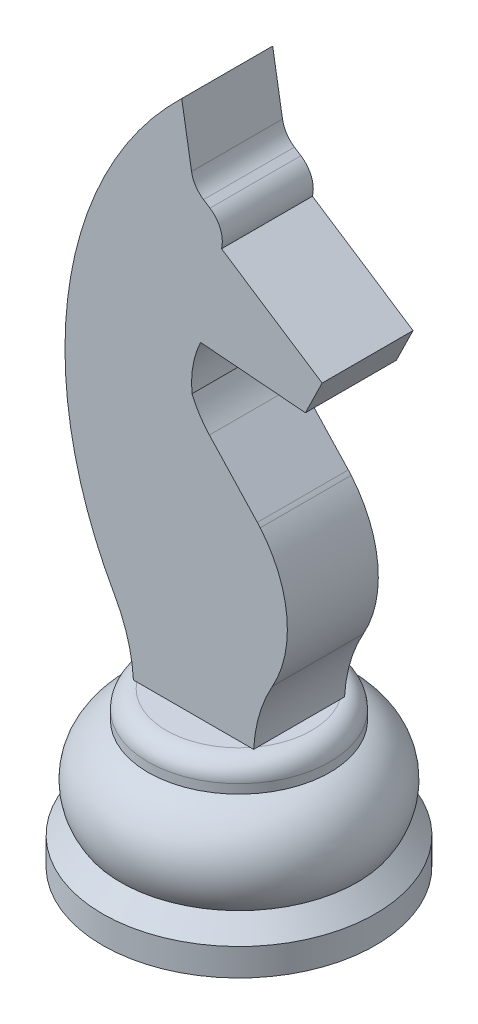
from build123d import *

# Parameters (mm, degrees)
BOSS_EXTRUDE1_DEPTH = 5
FILLET1_R           = 3
FILLET2_R           = 10
FILLET3_R           = 3


with BuildPart() as part:
    # Sketch1 → Revolve1 (revolve)
    with BuildSketch(Plane.XY, mode=Mode.PRIVATE) as revolve1_sk:
        with BuildLine():
            Line((0, 0), (-15, 0))
            Line((-15, 0), (-15, 3))
            Line((-15, 3), (-13, 5))
            ThreePointArc((-13, 5), (-13.688325627, 10.216881481), (-10, 13.97))
            Line((-10, 13.97), (-10, 14.97))
            ThreePointArc((-10, 14.97), (-9.414213562, 16.384213562), (-8, 16.97))
            Line((-8, 16.97), (0, 16.97))
            Line((0, 16.97), (0, 0))
        make_face()
    revolve(revolve1_sk.sketch.rotate(Axis((0, 0, 0), (0, 1, 0)), 270), axis=Axis((0, 0, 0), (0, 1, 0)))

    # Sketch2 → Boss-Extrude1 (add, symmetric)
    with BuildSketch(Plane.XY):
        with BuildLine():
            Line((-6.61, 16.97), (6.61, 16.97))
            ThreePointArc((6.61, 16.97), (7.232167752, 20.609337277), (8.67, 24.01))
            ThreePointArc((8.67, 24.01), (10.247857058, 31.593597712), (7.12, 38.68))
            Line((7.12, 38.68), (0, 46.35))
            Line((0, 46.35), (-1, 50.32))
            Line((-1, 50.32), (0.78, 52.81))
            Line((0.78, 52.81), (12.3, 51.87))
            Line((12.3, 51.87), (14.14, 55.62))
            Line((14.14, 55.62), (3.08, 62.88))
            Line((3.08, 62.88), (4.18, 64.56))
            Line((4.18, 64.56), (0, 67.29))
            Line((0, 67.29), (-1.295560409, 75))
            ThreePointArc((-1.295560409, 75), (-13.70107173, 50.765884766), (-8.67, 24.01))
            ThreePointArc((-8.67, 24.01), (-7.232167752, 20.609337277), (-6.61, 16.97))
        make_face()
    extrude(amount=BOSS_EXTRUDE1_DEPTH, both=True)

    # Fillet1
    fillet1_edges = [part.edges().sort_by_distance(p)[0] for p in [
        (0, 67.29, 0),
    ]]
    fillet(fillet1_edges, radius=FILLET1_R)

    # Fillet2
    # the kernel refuses this fillet: 10 mm, written as the material it adds along each edge
    with BuildSketch(Plane(origin=(-1, 50.32, -5), x_dir=(0.5815472036077696, 0.8135126612265992, 0), z_dir=(0, 0, 1))) as fillet2_piece_1:
        with BuildLine():
            CenterArc((4.753344766, -9.855723924), FILLET2_R, 99.744472398, 39.953038391)
            Line((-2.873057527, -3.387494795), (0, 0))
            Line((0, 0), (3.060800549, 0))
        make_face()
    extrude(amount=10)
    with BuildSketch(Plane(origin=(0, 46.35, -5), x_dir=(-0.24425942618290672, 0.9697099219461441, 0), z_dir=(0, 0, 1))) as fillet2_piece_2:
        with BuildLine():
            CenterArc((FILLET2_R * 0.256126103546, -FILLET2_R), FILLET2_R, 90, 28.732234305)
            Line((-FILLET2_R * 0.224590795698, -FILLET2_R * 0.123124146312), (0, 0))
            Line((0, 0), (FILLET2_R * 0.256126103546, 0))
        make_face()
    extrude(amount=10)
    # the kernel refuses this fillet: 10 mm, written as the material it takes off along each edge
    with BuildSketch(Plane(origin=(7.12, 38.68, -5.825464024), x_dir=(-0.6803411396995018, 0.7328955816706653, 0), z_dir=(0, 0, 1))) as fillet2_2_piece_1:
        with BuildLine():
            CenterArc((0.151797952, 10), FILLET2_R, 267.238538955, 2.761461045)
            ThreePointArc((-0.32998135, 0.011612307), (-0.165028474, 0.004732024), (0, 0))
            Line((0, 0), (0.151797952, 0))
        make_face()
    extrude(amount=11.650928049, mode=Mode.SUBTRACT)

    # Fillet3
    # the kernel refuses this fillet: 3 mm, written as the material it takes off along each edge
    with BuildSketch(Plane(origin=(4.18, 64.56, -12.08398788), x_dir=(-0.5477859413637723, -0.8366185286283144, 0), z_dir=(0, 0, 1))) as fillet3_piece_1:
        with BuildLine():
            CenterArc((3.003276632, -2.830122074), FILLET3_R, 109.373873229, 70.692421457)
            Line((0.00327864, -2.833593255), (-0.056721319, -2.833662679))
            Line((-0.056721319, -2.833662679), (-0.05999996, -6.9424e-05))
            Line((-0.05999996, -6.9424e-05), (0, 0.06))
            ThreePointArc((0, 0.06), (1.004041832, 0.06), (1.988179804, 0.056602441))
            Line((1.988179804, 0.056602441), (2.008083664, 0))
        make_face()
    extrude(amount=24.16797576, mode=Mode.SUBTRACT)


solid = part.part
